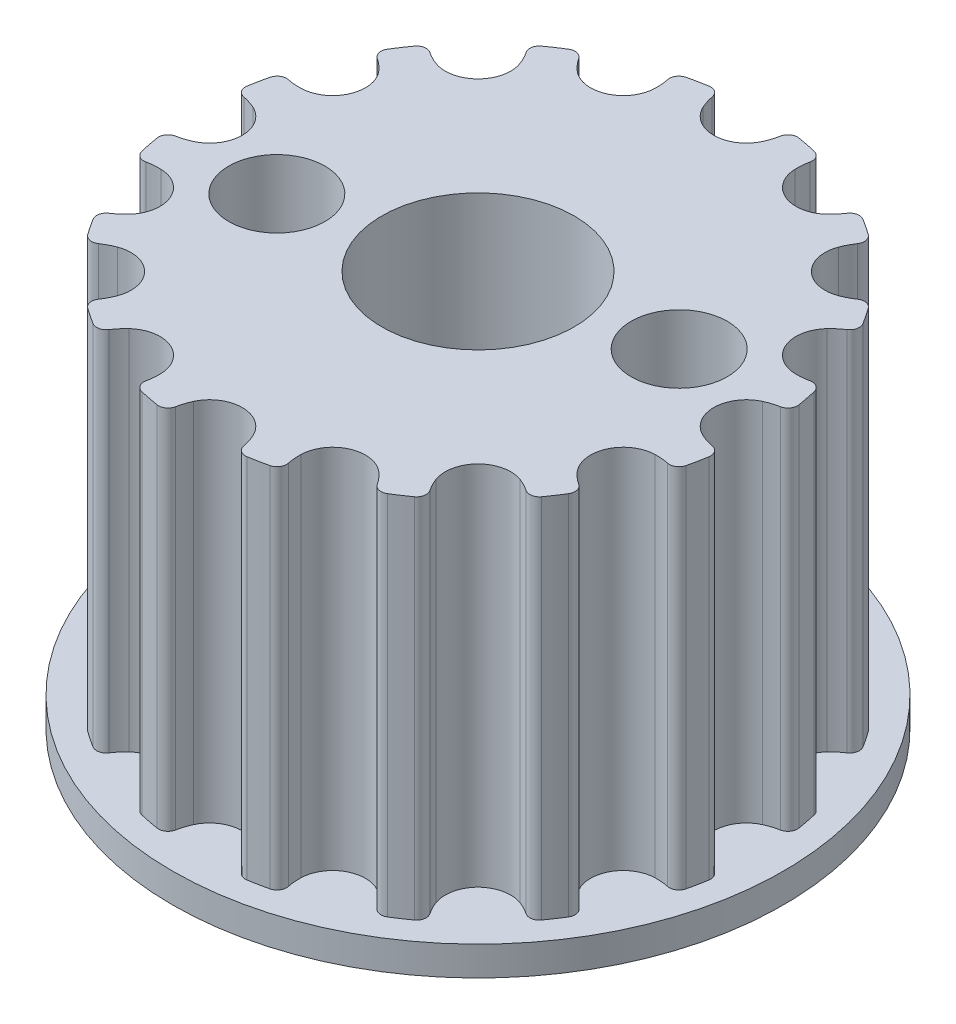
from build123d import *

# Parameters (mm, degrees)
SKETCH1_R           = 2.5
BOSS_EXTRUDE1_DEPTH = 4.7625
SKETCH2_R           = 7.9375
SKETCH2_R_2         = 2.5
BOSS_EXTRUDE2_DEPTH = 0.762
SKETCH4_R           = 1.25
CUT_EXTRUDE2_DEPTH  = 15.721869362
SKETCH5_R           = 1.5
CUT_EXTRUDE3_DEPTH  = 15.721869362


with BuildPart() as part:
    # Sketch1 → Boss-Extrude1 (new, symmetric)
    with BuildSketch(Plane(origin=(0, 0, 0), x_dir=(1, 0, 0), z_dir=(0, 1, 0))):
        with BuildLine():
            ThreePointArc((-1.850768, -6.777037356), (-1.816941892, -6.962421006), (-1.663291889, -7.071521784))
            ThreePointArc((-1.663291889, -7.071521784), (-1.417233644, -7.124914669), (-1.169472895, -7.169748489))
            ThreePointArc((-1.169472895, -7.169748489), (-0.985767742, -7.127751824), (-0.883573242, -6.969424355))
            ThreePointArc((-0.883573242, -6.969424355), (-0.839120956, -6.792881518), (-0.773880597, -6.622919538))
            ThreePointArc((-0.773880597, -6.622919538), (0, -6.1245), (0.773880597, -6.622919538))
            ThreePointArc((0.773880597, -6.622919538), (0.839120956, -6.792881518), (0.883573242, -6.969424355))
            ThreePointArc((0.883573242, -6.969424355), (0.985767742, -7.127751824), (1.169472895, -7.169748489))
            ThreePointArc((1.169472895, -7.169748489), (1.417233644, -7.124914669), (1.663291889, -7.071521784))
            ThreePointArc((1.663291889, -7.071521784), (1.816941892, -6.962421006), (1.850768, -6.777037356))
            ThreePointArc((1.850768, -6.777037356), (1.824276538, -6.596921889), (1.819509137, -6.414931089))
            ThreePointArc((1.819509137, -6.414931089), (2.343744682, -5.658300197), (3.249454025, -5.822628523))
            ThreePointArc((3.249454025, -5.822628523), (3.374769892, -5.954686513), (3.483398468, -6.100779674))
            ThreePointArc((3.483398468, -6.100779674), (3.638403174, -6.20794704), (3.824196033, -6.176445981))
            ThreePointArc((3.824196033, -6.176445981), (4.035939958, -6.040210999), (4.242835561, -5.896719991))
            ThreePointArc((4.242835561, -5.896719991), (4.343038594, -5.737124705), (4.303346591, -5.552907854))
            ThreePointArc((4.303346591, -5.552907854), (4.209944466, -5.396640704), (4.135895098, -5.230327534))
            ThreePointArc((4.135895098, -5.230327534), (4.330675481, -4.330675481), (5.230327534, -4.135895098))
            ThreePointArc((5.230327534, -4.135895098), (5.396640704, -4.209944466), (5.552907854, -4.303346591))
            ThreePointArc((5.552907854, -4.303346591), (5.737124705, -4.343038594), (5.896719991, -4.242835561))
            ThreePointArc((5.896719991, -4.242835561), (6.040210999, -4.035939958), (6.176445981, -3.824196033))
            ThreePointArc((6.176445981, -3.824196033), (6.20794704, -3.638403174), (6.100779674, -3.483398468))
            ThreePointArc((6.100779674, -3.483398468), (5.954686513, -3.374769892), (5.822628523, -3.249454025))
            ThreePointArc((5.822628523, -3.249454025), (5.658300197, -2.343744682), (6.414931089, -1.819509137))
            ThreePointArc((6.414931089, -1.819509137), (6.596921889, -1.824276538), (6.777037356, -1.850768))
            ThreePointArc((6.777037356, -1.850768), (6.962421006, -1.816941892), (7.071521784, -1.663291889))
            ThreePointArc((7.071521784, -1.663291889), (7.124914669, -1.417233644), (7.169748489, -1.169472895))
            ThreePointArc((7.169748489, -1.169472895), (7.127751824, -0.985767742), (6.969424355, -0.883573242))
            ThreePointArc((6.969424355, -0.883573242), (6.792881518, -0.839120956), (6.622919538, -0.773880597))
            ThreePointArc((6.622919538, -0.773880597), (6.1245, 0), (6.622919538, 0.773880597))
            ThreePointArc((6.622919538, 0.773880597), (6.792881518, 0.839120956), (6.969424355, 0.883573242))
            ThreePointArc((6.969424355, 0.883573242), (7.127751824, 0.985767742), (7.169748489, 1.169472895))
            ThreePointArc((7.169748489, 1.169472895), (7.124914669, 1.417233644), (7.071521784, 1.663291889))
            ThreePointArc((7.071521784, 1.663291889), (6.962421006, 1.816941892), (6.777037356, 1.850768))
            ThreePointArc((6.777037356, 1.850768), (6.596921889, 1.824276538), (6.414931089, 1.819509137))
            ThreePointArc((6.414931089, 1.819509137), (5.658300197, 2.343744682), (5.822628523, 3.249454025))
            ThreePointArc((5.822628523, 3.249454025), (5.954686513, 3.374769892), (6.100779674, 3.483398468))
            ThreePointArc((6.100779674, 3.483398468), (6.20794704, 3.638403174), (6.176445981, 3.824196033))
            ThreePointArc((6.176445981, 3.824196033), (6.040210999, 4.035939958), (5.896719991, 4.242835561))
            ThreePointArc((5.896719991, 4.242835561), (5.737124705, 4.343038594), (5.552907854, 4.303346591))
            ThreePointArc((5.552907854, 4.303346591), (5.396640704, 4.209944466), (5.230327534, 4.135895098))
            ThreePointArc((5.230327534, 4.135895098), (4.330675481, 4.330675481), (4.135895098, 5.230327534))
            ThreePointArc((4.135895098, 5.230327534), (4.209944466, 5.396640704), (4.303346591, 5.552907854))
            ThreePointArc((4.303346591, 5.552907854), (4.343038594, 5.737124705), (4.242835561, 5.896719991))
            ThreePointArc((4.242835561, 5.896719991), (4.035939958, 6.040210999), (3.824196033, 6.176445981))
            ThreePointArc((3.824196033, 6.176445981), (3.638403174, 6.20794704), (3.483398468, 6.100779674))
            ThreePointArc((3.483398468, 6.100779674), (3.374769892, 5.954686513), (3.249454025, 5.822628523))
            ThreePointArc((3.249454025, 5.822628523), (2.343744682, 5.658300197), (1.819509137, 6.414931089))
            ThreePointArc((1.819509137, 6.414931089), (1.824276538, 6.596921889), (1.850768, 6.777037356))
            ThreePointArc((1.850768, 6.777037356), (1.816941892, 6.962421006), (1.663291889, 7.071521784))
            ThreePointArc((1.663291889, 7.071521784), (1.417233644, 7.124914669), (1.169472895, 7.169748489))
            ThreePointArc((1.169472895, 7.169748489), (0.985767742, 7.127751824), (0.883573242, 6.969424355))
            ThreePointArc((0.883573242, 6.969424355), (0.839120956, 6.792881518), (0.773880597, 6.622919538))
            ThreePointArc((0.773880597, 6.622919538), (0, 6.1245), (-0.773880597, 6.622919538))
            ThreePointArc((-0.773880597, 6.622919538), (-0.839120956, 6.792881518), (-0.883573242, 6.969424355))
            ThreePointArc((-0.883573242, 6.969424355), (-0.985767742, 7.127751824), (-1.169472895, 7.169748489))
            ThreePointArc((-1.169472895, 7.169748489), (-1.417233644, 7.124914669), (-1.663291889, 7.071521784))
            ThreePointArc((-1.663291889, 7.071521784), (-1.816941892, 6.962421006), (-1.850768, 6.777037356))
            ThreePointArc((-1.850768, 6.777037356), (-1.824276538, 6.596921889), (-1.819509137, 6.414931089))
            ThreePointArc((-1.819509137, 6.414931089), (-2.343744682, 5.658300197), (-3.249454025, 5.822628523))
            ThreePointArc((-3.249454025, 5.822628523), (-3.374769892, 5.954686513), (-3.483398468, 6.100779674))
            ThreePointArc((-3.483398468, 6.100779674), (-3.638403174, 6.20794704), (-3.824196033, 6.176445981))
            ThreePointArc((-3.824196033, 6.176445981), (-4.035939958, 6.040210999), (-4.242835561, 5.896719991))
            ThreePointArc((-4.242835561, 5.896719991), (-4.343038594, 5.737124705), (-4.303346591, 5.552907854))
            ThreePointArc((-4.303346591, 5.552907854), (-4.209944466, 5.396640704), (-4.135895098, 5.230327534))
            ThreePointArc((-4.135895098, 5.230327534), (-4.330675481, 4.330675481), (-5.230327534, 4.135895098))
            ThreePointArc((-5.230327534, 4.135895098), (-5.396640704, 4.209944466), (-5.552907854, 4.303346591))
            ThreePointArc((-5.552907854, 4.303346591), (-5.737124705, 4.343038594), (-5.896719991, 4.242835561))
            ThreePointArc((-5.896719991, 4.242835561), (-6.040210999, 4.035939958), (-6.176445981, 3.824196033))
            ThreePointArc((-6.176445981, 3.824196033), (-6.20794704, 3.638403174), (-6.100779674, 3.483398468))
            ThreePointArc((-6.100779674, 3.483398468), (-5.954686513, 3.374769892), (-5.822628523, 3.249454025))
            ThreePointArc((-5.822628523, 3.249454025), (-5.658300197, 2.343744682), (-6.414931089, 1.819509137))
            ThreePointArc((-6.414931089, 1.819509137), (-6.596921889, 1.824276538), (-6.777037356, 1.850768))
            ThreePointArc((-6.777037356, 1.850768), (-6.962421006, 1.816941892), (-7.071521784, 1.663291889))
            ThreePointArc((-7.071521784, 1.663291889), (-7.124914669, 1.417233644), (-7.169748489, 1.169472895))
            ThreePointArc((-7.169748489, 1.169472895), (-7.127751824, 0.985767742), (-6.969424355, 0.883573242))
            ThreePointArc((-6.969424355, 0.883573242), (-6.792881518, 0.839120956), (-6.622919538, 0.773880597))
            ThreePointArc((-6.622919538, 0.773880597), (-6.1245, 0), (-6.622919538, -0.773880597))
            ThreePointArc((-6.622919538, -0.773880597), (-6.792881518, -0.839120956), (-6.969424355, -0.883573242))
            ThreePointArc((-6.969424355, -0.883573242), (-7.127751824, -0.985767742), (-7.169748489, -1.169472895))
            ThreePointArc((-7.169748489, -1.169472895), (-7.124914669, -1.417233644), (-7.071521784, -1.663291889))
            ThreePointArc((-7.071521784, -1.663291889), (-6.962421006, -1.816941892), (-6.777037356, -1.850768))
            ThreePointArc((-6.777037356, -1.850768), (-6.596921889, -1.824276538), (-6.414931089, -1.819509137))
            ThreePointArc((-6.414931089, -1.819509137), (-5.658300197, -2.343744682), (-5.822628523, -3.249454025))
            ThreePointArc((-5.822628523, -3.249454025), (-5.954686513, -3.374769892), (-6.100779674, -3.483398468))
            ThreePointArc((-6.100779674, -3.483398468), (-6.20794704, -3.638403174), (-6.176445981, -3.824196033))
            ThreePointArc((-6.176445981, -3.824196033), (-6.040210999, -4.035939958), (-5.896719991, -4.242835561))
            ThreePointArc((-5.896719991, -4.242835561), (-5.737124705, -4.343038594), (-5.552907854, -4.303346591))
            ThreePointArc((-5.552907854, -4.303346591), (-5.396640704, -4.209944466), (-5.230327534, -4.135895098))
            ThreePointArc((-5.230327534, -4.135895098), (-4.330675481, -4.330675481), (-4.135895098, -5.230327534))
            ThreePointArc((-4.135895098, -5.230327534), (-4.209944466, -5.396640704), (-4.303346591, -5.552907854))
            ThreePointArc((-4.303346591, -5.552907854), (-4.343038594, -5.737124705), (-4.242835561, -5.896719991))
            ThreePointArc((-4.242835561, -5.896719991), (-4.035939958, -6.040210999), (-3.824196033, -6.176445981))
            ThreePointArc((-3.824196033, -6.176445981), (-3.638403174, -6.20794704), (-3.483398468, -6.100779674))
            ThreePointArc((-3.483398468, -6.100779674), (-3.374769892, -5.954686513), (-3.249454025, -5.822628523))
            ThreePointArc((-3.249454025, -5.822628523), (-2.343744682, -5.658300197), (-1.819509137, -6.414931089))
            ThreePointArc((-1.819509137, -6.414931089), (-1.824276538, -6.596921889), (-1.850768, -6.777037356))
        make_face()
        Circle(SKETCH1_R, mode=Mode.SUBTRACT)
    extrude(amount=BOSS_EXTRUDE1_DEPTH, both=True)

    # Sketch4 → Cut-Extrude2 (cut, through all)
    with BuildSketch(Plane.XZ.offset(4.7625)):
        with Locations((-4.359590571, 0.867176481)):
            Circle(SKETCH4_R)
        with Locations((4.359590571, -0.867176481)):
            Circle(SKETCH4_R)
    extrude(amount=-CUT_EXTRUDE2_DEPTH, mode=Mode.SUBTRACT)


with BuildPart() as body_2:
    # Sketch2 → Boss-Extrude2 (new body)
    with BuildSketch(Plane.XZ.offset(4.7625)):
        Circle(SKETCH2_R)
        Circle(SKETCH2_R_2, mode=Mode.SUBTRACT)
    extrude(amount=BOSS_EXTRUDE2_DEPTH)

    # Sketch5 → Cut-Extrude3 (cut, through all)
    with BuildSketch(Plane(origin=(0, -4.7625, 0), x_dir=(1, 0, 0), z_dir=(0, 1, 0))):
        with Locations((-4.359590571, -0.867176481)):
            Circle(SKETCH5_R)
        with Locations((4.359590571, 0.867176481)):
            Circle(SKETCH5_R)
    extrude(amount=-CUT_EXTRUDE3_DEPTH, mode=Mode.SUBTRACT)


solid = Compound([part.part, body_2.part])
